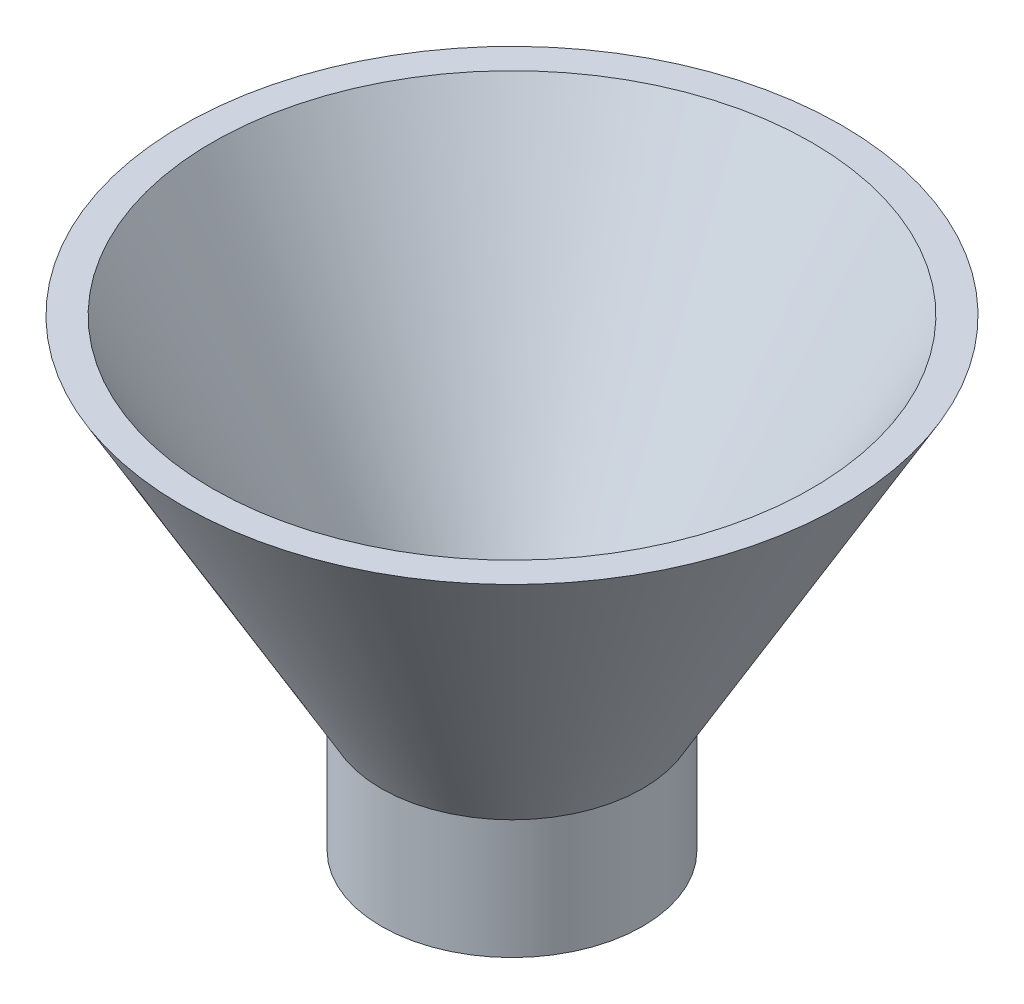
from build123d import *

# Parameters (mm, degrees)
SKETCH1_R           = 13.15
SKETCH1_R_2         = 10.15
BOSS_EXTRUDE1_DEPTH = 12
FILLET1_R           = 10


with BuildPart() as part:
    # Sketch1 → Boss-Extrude1 (new body)
    with BuildSketch(Plane(origin=(0, 0, 0), x_dir=(1, 0, 0), z_dir=(0, 1, 0))):
        Circle(SKETCH1_R)
        Circle(SKETCH1_R_2, mode=Mode.SUBTRACT)
    extrude(amount=BOSS_EXTRUDE1_DEPTH)

    # Sketch2 → Revolve1 (revolve)
    with BuildSketch(Plane.XY):
        Polygon((-13.15, 12), (-33.15, 46.641016151), (-30.15, 46.641016151), (-10.15, 12), align=None)
    revolve(axis=Axis((0, 0, 0), (0, 1, 0)))

    # Fillet1
    fillet1_edges = [part.edges().sort_by_distance(p)[0] for p in [
        (0, 12, -10.15),
    ]]
    fillet(fillet1_edges, radius=FILLET1_R)


solid = part.part
